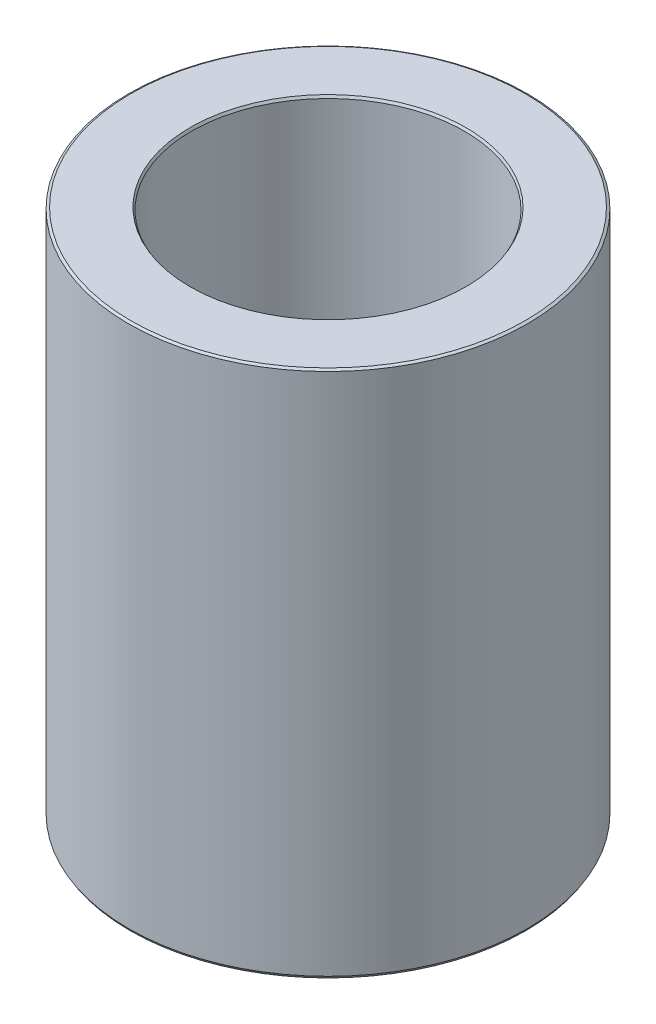
from build123d import *
from OCP.BRepFilletAPI import BRepFilletAPI_MakeChamfer

# Parameters (mm, degrees)
SKETCH1_R           = 32.5
BOSS_EXTRUDE1_DEPTH = 86.011503784
SKETCH2_R           = 22.256509279
CUT_EXTRUDE1_DEPTH  = 98.521683656
CHAMFER1_SIZE       = 0.229177655
CHAMFER1_SIZE2      = 0.396947343


with BuildPart() as part:
    # Sketch1 → Boss-Extrude1 (new body)
    with BuildSketch(Plane(origin=(0, 0, 0), x_dir=(1, 0, 0), z_dir=(0, 1, 0))):
        Circle(SKETCH1_R)
    extrude(amount=BOSS_EXTRUDE1_DEPTH)

    # Sketch2 → Cut-Extrude1 (cut, through all)
    with BuildSketch(Plane(origin=(0, 0, 0), x_dir=(1, 0, 0), z_dir=(0, 1, 0))):
        Circle(SKETCH2_R)
    extrude(amount=CUT_EXTRUDE1_DEPTH, mode=Mode.SUBTRACT)

    # Chamfer1: one chamfer whose edges measure the first distance from different faces: ONE call of the kernel's chamfer builder (chamfer() names one face for all edges)
    chamfer1_edges_1 = [part.edges().sort_by_distance(p)[0] for p in [
        (-22.256509279, 86.011503784, 0),
    ]]
    chamfer1_side_1 = [part.faces().sort_by_distance(p)[0] for p in [
        (-31.580761184, 86.011503784, 0),
    ]]
    chamfer1_edges_2 = [part.edges().sort_by_distance(p)[0] for p in [
        (-22.256509279, 0, 0),
    ]]
    chamfer1_side_2 = [part.faces().sort_by_distance(p)[0] for p in [
        (-22.256509279, 43.005751892, 0),
    ]]
    chamfer1_edges_3 = [part.edges().sort_by_distance(p)[0] for p in [
        (-32.5, 0, 0),
    ]]
    chamfer1_side_3 = [part.faces().sort_by_distance(p)[0] for p in [
        (-31.580761184, 0, 0),
    ]]
    chamfer1_edges_4 = [part.edges().sort_by_distance(p)[0] for p in [
        (-32.5, 86.011503784, 0),
    ]]
    chamfer1_side_4 = [part.faces().sort_by_distance(p)[0] for p in [
        (-32.5, 43.005751892, 0),
    ]]
    chamfer1 = BRepFilletAPI_MakeChamfer(part.part.solid().wrapped)
    for e in chamfer1_edges_1:
        chamfer1.Add(CHAMFER1_SIZE, CHAMFER1_SIZE2, e.wrapped, chamfer1_side_1[0].wrapped)  # the first distance lies on this face
    for e in chamfer1_edges_2:
        chamfer1.Add(CHAMFER1_SIZE, CHAMFER1_SIZE2, e.wrapped, chamfer1_side_2[0].wrapped)  # the first distance lies on this face
    for e in chamfer1_edges_3:
        chamfer1.Add(CHAMFER1_SIZE, CHAMFER1_SIZE2, e.wrapped, chamfer1_side_3[0].wrapped)  # the first distance lies on this face
    for e in chamfer1_edges_4:
        chamfer1.Add(CHAMFER1_SIZE, CHAMFER1_SIZE2, e.wrapped, chamfer1_side_4[0].wrapped)  # the first distance lies on this face
    add(Compound.cast(chamfer1.Shape()), mode=Mode.REPLACE)


solid = part.part
